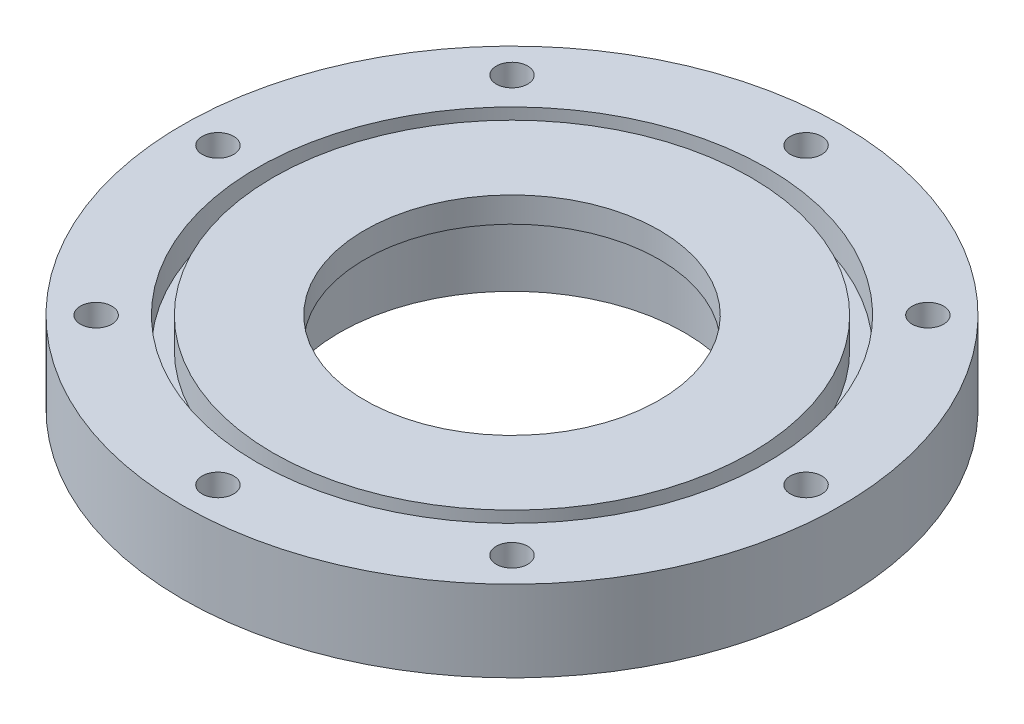
from build123d import *

# Parameters (mm, degrees)
ESQUISSE2_R             = 3.1
ENL_V_MAT_EXTRU_1_DEPTH = 95.074438611
ESQUISSE4_OUTSIDE_W     = 168.986
ESQUISSE4_OUTSIDE_H     = 168.986
ESQUISSE4_OUTSIDE_R     = 42.05
ENL_V_MAT_EXTRU_3_DEPTH = 4
ESQUISSE3_R             = 5.1
ENL_V_MAT_EXTRU_2_DEPTH = 6.2


with BuildPart() as part:
    # Esquisse1 → Révolution1 (revolve)
    with BuildSketch(Plane.XY):
        Polygon((-34.05, 0), (-34.05, 15), (-29.05, 15), (-29.05, 20), (-47.1, 20), (-47.1, 14), (-50.3, 14), (-50.3, 20), (-65, 20), (-65, 0), align=None)
    revolve(axis=Axis((0, 0, 0), (0, 1, 0)))

    # Esquisse2 → Enlèv. mat.-Extru.1 (cut, through all)
    with BuildSketch(Plane.XZ):
        with Locations((0, 58)):
            Circle(ESQUISSE2_R)
        with Locations((41.012193309, 41.012193309)):
            Circle(ESQUISSE2_R)
        with Locations((58, 0)):
            Circle(ESQUISSE2_R)
        with Locations((41.012193309, -41.012193309)):
            Circle(ESQUISSE2_R)
        with Locations((0, -58)):
            Circle(ESQUISSE2_R)
        with Locations((-41.012193309, -41.012193309)):
            Circle(ESQUISSE2_R)
        with Locations((-58, 0)):
            Circle(ESQUISSE2_R)
        with Locations((-41.012193309, 41.012193309)):
            Circle(ESQUISSE2_R)
    extrude(amount=-ENL_V_MAT_EXTRU_1_DEPTH, mode=Mode.SUBTRACT)

    # Esquisse4 outside → Enlèv. mat.-Extru.3 (cut)
    with BuildSketch(Plane.XZ):
        Rectangle(ESQUISSE4_OUTSIDE_W, ESQUISSE4_OUTSIDE_H)
        Circle(ESQUISSE4_OUTSIDE_R, mode=Mode.SUBTRACT)
    extrude(amount=-ENL_V_MAT_EXTRU_3_DEPTH, mode=Mode.SUBTRACT)

    # Esquisse3 → Enlèv. mat.-Extru.2 (cut)
    with BuildSketch(Plane.XZ.offset(-4)):
        with Locations((0, 58)):
            Circle(ESQUISSE3_R)
        with Locations((41.012193309, 41.012193309)):
            Circle(ESQUISSE3_R)
        with Locations((58, 0)):
            Circle(ESQUISSE3_R)
        with Locations((41.012193309, -41.012193309)):
            Circle(ESQUISSE3_R)
        with Locations((0, -58)):
            Circle(ESQUISSE3_R)
        with Locations((-41.012193309, -41.012193309)):
            Circle(ESQUISSE3_R)
        with Locations((-58, 0)):
            Circle(ESQUISSE3_R)
        with Locations((-41.012193309, 41.012193309)):
            Circle(ESQUISSE3_R)
    extrude(amount=-ENL_V_MAT_EXTRU_2_DEPTH, mode=Mode.SUBTRACT)


solid = part.part
